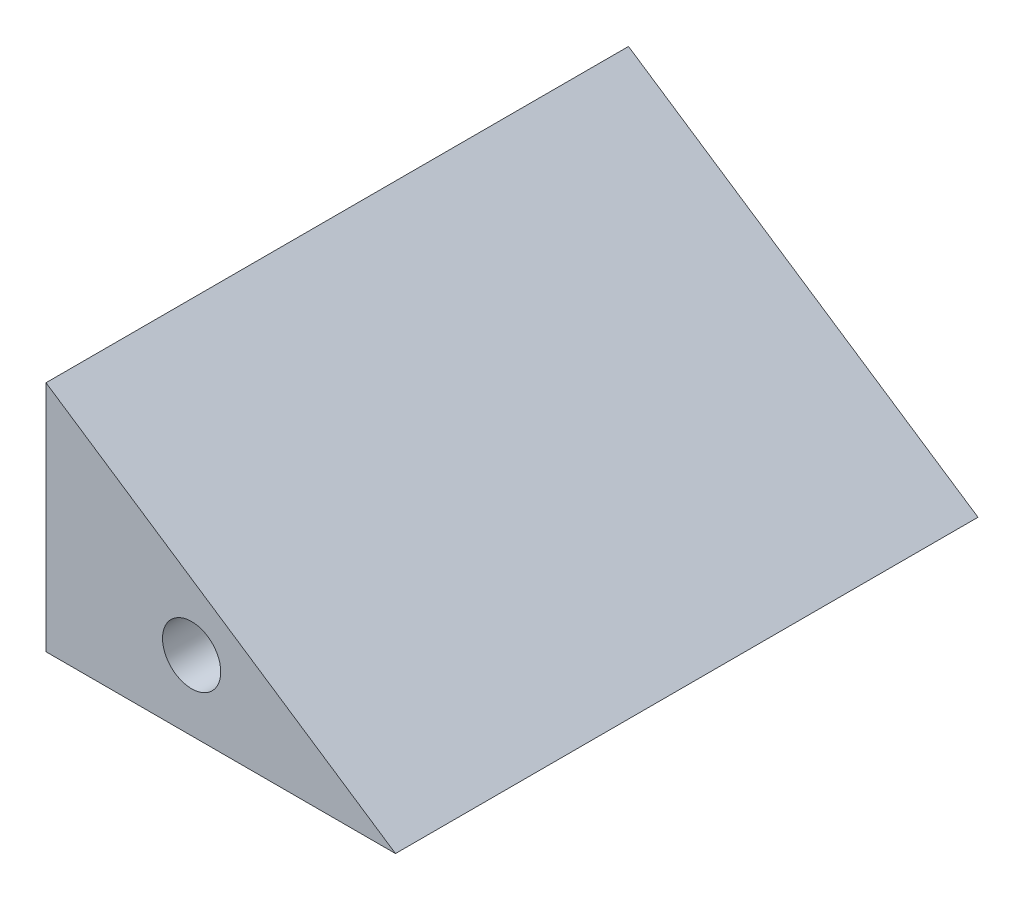
from build123d import *

# Parameters (mm, degrees)
SKETCH_1_R        = 5
EXTRUDE_389_DEPTH = 100


with BuildPart() as part:
    # Эскиз1 → Extrude 389 (new body)
    with BuildSketch(Plane.XY):
        Polygon((0, 0), (0, 40), (60, 0), align=None)
        with Locations((25, 12)):
            Circle(SKETCH_1_R, mode=Mode.SUBTRACT)
    extrude(amount=EXTRUDE_389_DEPTH)


solid = part.part
